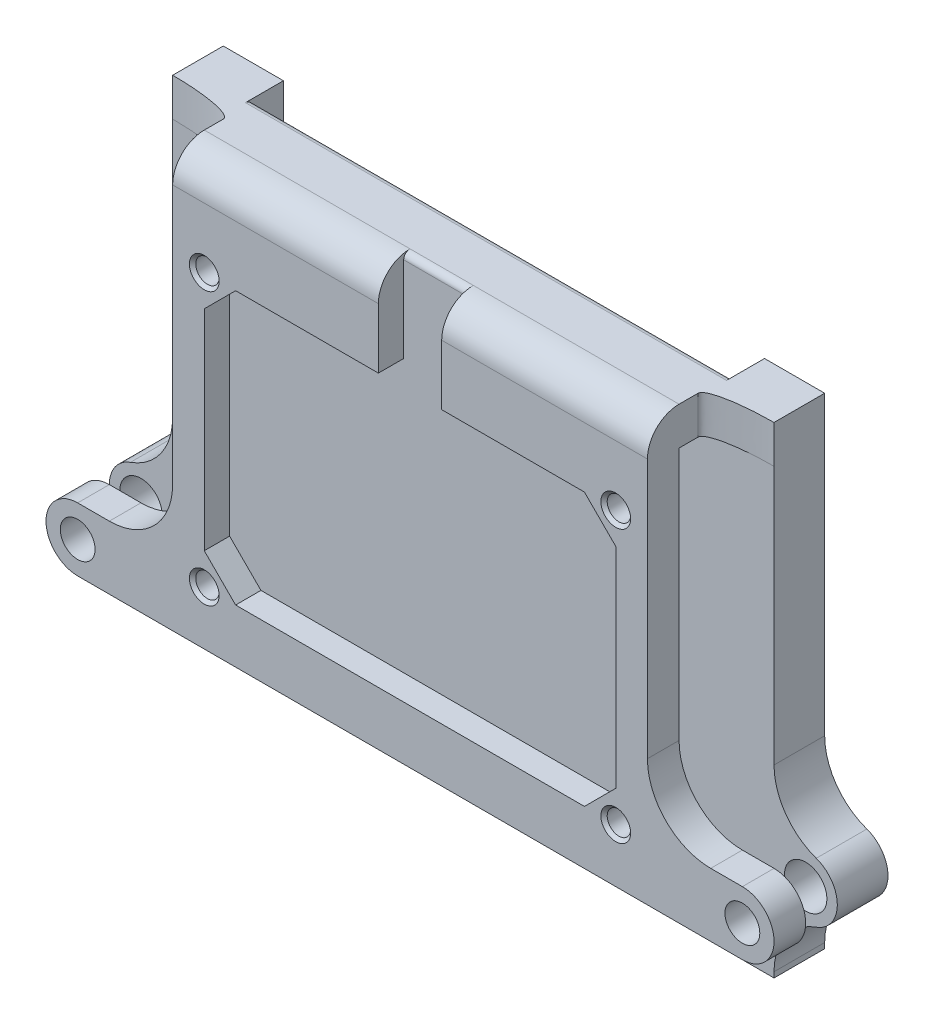
from build123d import *

# Parameters (mm, degrees)
SKETCH1_W           = 75
SKETCH1_H           = 6
SKETCH1_H_2         = 60
BOSS_EXTRUDE1_DEPTH = 5
SKETCH2_W           = 10
SKETCH2_H           = 14.5
CUT_EXTRUDE1_DEPTH  = 4
CUT_EXTRUDE2_DEPTH  = 4.5
SKETCH3_W           = 75
SKETCH3_H           = 6
BOSS_EXTRUDE2_DEPTH = 5
SKETCH4_W           = 95
SKETCH4_H           = 76
BOSS_EXTRUDE3_DEPTH = 8
SKETCH5_W           = 76
SKETCH5_H           = 76
CUT_EXTRUDE3_DEPTH  = 5
SKETCH5_3_R         = 1.85
CUT_EXTRUDE4_DEPTH  = 4.5
FILLET1_R           = 1
FILLET2_R           = 5
FILLET3_SIZE        = 10
FILLET3_SIZE_2      = 2
BOSS_EXTRUDE4_DEPTH = 5
BOSS_EXTRUDE5_START = -8
SKETCH8_R           = 5
SKETCH8_R_2         = 3.35
BOSS_EXTRUDE5_DEPTH = 8
FILLET4_R           = 10
CHAMFER1_SIZE       = 0.5


with BuildPart() as part:
    # Sketch1 → Boss-Extrude1 (new body)
    with BuildSketch(Plane.XY):
        with Locations((0, 83)):
            Rectangle(SKETCH1_W, SKETCH1_H)
        with Locations((0, 50)):
            Rectangle(SKETCH1_W, SKETCH1_H_2)
    extrude(amount=BOSS_EXTRUDE1_DEPTH)

    # Sketch2 → Cut-Extrude1 (cut)
    with BuildSketch(Plane.XY.offset(5)):
        Polygon((-27.550252532, 71.5), (-32.5, 66.550252532), (-32.5, 33.449747468), (-27.550252532, 28.5), (27.550252532, 28.5), (32.5, 33.449747468), (32.5, 66.550252532), (27.550252532, 71.5), (5, 71.5), (-5, 71.5), align=None)
        with Locations((0, 78.75)):
            Rectangle(SKETCH2_W, SKETCH2_H)
    extrude(amount=-CUT_EXTRUDE1_DEPTH, mode=Mode.SUBTRACT)

    # Sketch2<3> → Cut-Extrude2 (cut)
    with BuildSketch(Plane.XY.offset(5)):
        with BuildLine():
            ThreePointArc((-30.65, 71.5), (-33.808147545, 72.808147545), (-32.5, 69.65))
            Line((-32.5, 69.65), (-32.5, 71.5))
            Line((-32.5, 71.5), (-30.65, 71.5))
        make_face()
        with BuildLine():
            Line((-32.5, 71.5), (-32.5, 69.65))
            ThreePointArc((-32.5, 69.65), (-31.191852455, 70.191852455), (-30.65, 71.5))
            Line((-30.65, 71.5), (-32.5, 71.5))
        make_face()
        with BuildLine():
            ThreePointArc((34.35, 71.5), (32.5, 73.35), (30.65, 71.5))
            Line((30.65, 71.5), (32.5, 71.5))
            Line((32.5, 71.5), (32.5, 69.65))
            ThreePointArc((32.5, 69.65), (33.808147545, 70.191852455), (34.35, 71.5))
        make_face()
        with BuildLine():
            Line((32.5, 71.5), (30.65, 71.5))
            ThreePointArc((30.65, 71.5), (31.191852455, 70.191852455), (32.5, 69.65))
            Line((32.5, 69.65), (32.5, 71.5))
        make_face()
        with BuildLine():
            ThreePointArc((32.5, 30.35), (31.191852455, 29.808147545), (30.65, 28.5))
            Line((30.65, 28.5), (32.5, 28.5))
            Line((32.5, 28.5), (32.5, 30.35))
        make_face()
        with BuildLine():
            Line((32.5, 28.5), (30.65, 28.5))
            ThreePointArc((30.65, 28.5), (32.5, 26.65), (34.35, 28.5))
            ThreePointArc((34.35, 28.5), (33.808147545, 29.808147545), (32.5, 30.35))
            Line((32.5, 30.35), (32.5, 28.5))
        make_face()
        with BuildLine():
            ThreePointArc((-30.65, 28.5), (-31.191852455, 29.808147545), (-32.5, 30.35))
            Line((-32.5, 30.35), (-32.5, 28.5))
            Line((-32.5, 28.5), (-30.65, 28.5))
        make_face()
        with BuildLine():
            Line((-32.5, 28.5), (-32.5, 30.35))
            ThreePointArc((-32.5, 30.35), (-33.808147545, 27.191852455), (-30.65, 28.5))
            Line((-30.65, 28.5), (-32.5, 28.5))
        make_face()
    extrude(amount=-CUT_EXTRUDE2_DEPTH, mode=Mode.SUBTRACT)

    # Sketch3 → Boss-Extrude2 (add)
    with BuildSketch(Plane(origin=(0, 0, 0), x_dir=(-1, 0, 0), z_dir=(0, 0, -1))):
        with Locations((0, 83)):
            Rectangle(SKETCH3_W, SKETCH3_H)
    extrude(amount=BOSS_EXTRUDE2_DEPTH)

    # Sketch4 → Boss-Extrude3 (add)
    with BuildSketch(Plane(origin=(0, 0, -5), x_dir=(-1, 0, 0), z_dir=(0, 0, -1))):
        with Locations((0, 48)):
            Rectangle(SKETCH4_W, SKETCH4_H)
    extrude(amount=BOSS_EXTRUDE3_DEPTH)

    # Sketch5 → Cut-Extrude3 (cut)
    with BuildSketch(Plane(origin=(0, 0, -13), x_dir=(-1, 0, 0), z_dir=(0, 0, -1))):
        with Locations((0, 48)):
            Rectangle(SKETCH5_W, SKETCH5_H)
    extrude(amount=-CUT_EXTRUDE3_DEPTH, mode=Mode.SUBTRACT)

    # Sketch5<3> → Cut-Extrude4 (cut)
    with BuildSketch(Plane(origin=(0, 0, -13), x_dir=(-1, 0, 0), z_dir=(0, 0, -1))):
        with Locations((-41.5, 79)):
            Circle(SKETCH5_3_R)
        with Locations((-41.5, 21)):
            Circle(SKETCH5_3_R)
        with Locations((41.5, 21)):
            Circle(SKETCH5_3_R)
        with Locations((41.5, 79)):
            Circle(SKETCH5_3_R)
    extrude(amount=-CUT_EXTRUDE4_DEPTH, mode=Mode.SUBTRACT)

    # Fillet1
    fillet1_edges = [part.edges().sort_by_distance(p)[0] for p in [
        (0, 86, -8),
        (0, 86, 1),
    ]]
    fillet(fillet1_edges, radius=FILLET1_R)

    # Fillet2
    fillet2_edges = [part.edges().sort_by_distance(p)[0] for p in [
        (21.25, 86, 5),
        (-21.25, 86, 5),
    ]]
    fillet(fillet2_edges, radius=FILLET2_R)

    # Fillet3
    # an asymmetric fillet: 10, 2 mm, written as the material it adds along each edge
    with BuildSketch(Plane(origin=(37.5, 80, -5), x_dir=(1, 0, 0), z_dir=(0, 1, 0))) as fillet3_piece_1:
        with BuildLine():
            Bezier((FILLET3_SIZE, 0), (0, 0), (0, -FILLET3_SIZE_2), weights=[1, 0.707106781, 1])
            Line((0, -FILLET3_SIZE_2), (0, 0))
            Line((0, 0), (FILLET3_SIZE, 0))
        make_face()
    extrude(amount=6)
    with BuildSketch(Plane(origin=(-37.5, 86, -5), x_dir=(0, 0, 1), z_dir=(0, -1, 0))) as fillet3_piece_2:
        with BuildLine():
            Bezier((FILLET3_SIZE_2, 0), (0, 0), (0, FILLET3_SIZE), weights=[1, 0.707106781, 1])
            Line((0, FILLET3_SIZE), (0, 0))
            Line((0, 0), (FILLET3_SIZE_2, 0))
        make_face()
    extrude(amount=6)

    # Sketch7 → Boss-Extrude4 (add)
    with BuildSketch(Plane.XY.offset(5)):
        with BuildLine():
            Line((37.5, 30), (37.5, 20))
            Line((37.5, 20), (52.5, 20))
            ThreePointArc((52.5, 20), (47.5, 25), (52.5, 30))
            Line((52.5, 30), (37.5, 30))
        make_face()
        with BuildLine():
            ThreePointArc((52.5, 30), (47.5, 25), (52.5, 20))
            Line((52.5, 20), (52.5, 22.25))
            ThreePointArc((52.5, 22.25), (49.75, 25), (52.5, 27.75))
            Line((52.5, 27.75), (52.5, 30))
        make_face()
        with BuildLine():
            Line((52.5, 22.25), (52.5, 20))
            ThreePointArc((52.5, 20), (56.035533906, 21.464466094), (57.5, 25))
            ThreePointArc((57.5, 25), (56.035533906, 28.535533906), (52.5, 30))
            Line((52.5, 30), (52.5, 27.75))
            ThreePointArc((52.5, 27.75), (54.444543648, 26.944543648), (55.25, 25))
            ThreePointArc((55.25, 25), (54.444543648, 23.055456352), (52.5, 22.25))
        make_face()
        with BuildLine():
            Line((-37.5, 20), (-37.5, 30))
            Line((-37.5, 30), (-52.5, 30))
            ThreePointArc((-52.5, 30), (-48.964466094, 28.535533906), (-47.5, 25))
            ThreePointArc((-47.5, 25), (-48.964466094, 21.464466094), (-52.5, 20))
            Line((-52.5, 20), (-37.5, 20))
        make_face()
        with BuildLine():
            ThreePointArc((-47.5, 25), (-48.964466094, 28.535533906), (-52.5, 30))
            Line((-52.5, 30), (-52.5, 27.75))
            ThreePointArc((-52.5, 27.75), (-50.555456352, 26.944543648), (-49.75, 25))
            ThreePointArc((-49.75, 25), (-50.555456352, 23.055456352), (-52.5, 22.25))
            Line((-52.5, 22.25), (-52.5, 20))
            ThreePointArc((-52.5, 20), (-48.964466094, 21.464466094), (-47.5, 25))
        make_face()
        with BuildLine():
            Line((-52.5, 27.75), (-52.5, 30))
            ThreePointArc((-52.5, 30), (-57.5, 25), (-52.5, 20))
            Line((-52.5, 20), (-52.5, 22.25))
            ThreePointArc((-52.5, 22.25), (-55.25, 25), (-52.5, 27.75))
        make_face()
    extrude(amount=-BOSS_EXTRUDE4_DEPTH)

    # Sketch8 → Boss-Extrude5 (add)
    # profile 1 of 6: a face of its own
    with BuildSketch(Plane(origin=(0, 0, -13), x_dir=(-1, 0, 0), z_dir=(0, 0, -1)).offset(BOSS_EXTRUDE5_START)):
        with BuildLine():
            Line((-47.5, 20), (-47.5, 25))
            ThreePointArc((-47.5, 25), (-48.964466094, 21.464466094), (-52.5, 20))
            Line((-52.5, 20), (-47.5, 20))
        make_face()
    # profile 2 of 6: a face of its own
    with BuildSketch(Plane(origin=(0, 0, -13), x_dir=(-1, 0, 0), z_dir=(0, 0, -1)).offset(BOSS_EXTRUDE5_START)):
        with BuildLine():
            Line((-47.5, 30), (-52.5, 30))
            ThreePointArc((-52.5, 30), (-48.964466094, 28.535533906), (-47.5, 25))
            Line((-47.5, 25), (-47.5, 30))
        make_face()
    # profile 3 of 6: a face of its own
    with BuildSketch(Plane(origin=(0, 0, -13), x_dir=(-1, 0, 0), z_dir=(0, 0, -1)).offset(BOSS_EXTRUDE5_START)):
        with Locations((-52.5, 25)):
            Circle(SKETCH8_R)
        with Locations((-52.5, 25)):
            Circle(SKETCH8_R_2, mode=Mode.SUBTRACT)
    # profile 4 of 6: a face of its own
    with BuildSketch(Plane(origin=(0, 0, -13), x_dir=(-1, 0, 0), z_dir=(0, 0, -1)).offset(BOSS_EXTRUDE5_START)):
        with BuildLine():
            Line((47.5, 30), (47.5, 25))
            ThreePointArc((47.5, 25), (48.964466094, 28.535533906), (52.5, 30))
            Line((52.5, 30), (47.5, 30))
        make_face()
    # profile 5 of 6: a face of its own
    with BuildSketch(Plane(origin=(0, 0, -13), x_dir=(-1, 0, 0), z_dir=(0, 0, -1)).offset(BOSS_EXTRUDE5_START)):
        with BuildLine():
            Line((47.5, 25), (47.5, 20))
            Line((47.5, 20), (52.5, 20))
            ThreePointArc((52.5, 20), (48.964466094, 21.464466094), (47.5, 25))
        make_face()
    # profile 6 of 6: a face of its own
    with BuildSketch(Plane(origin=(0, 0, -13), x_dir=(-1, 0, 0), z_dir=(0, 0, -1)).offset(BOSS_EXTRUDE5_START)):
        with Locations((52.5, 25)):
            Circle(SKETCH8_R)
        with Locations((52.5, 25)):
            Circle(SKETCH8_R_2, mode=Mode.SUBTRACT)
    extrude(amount=BOSS_EXTRUDE5_DEPTH)

    # Fillet4
    # the kernel refuses this fillet: 10 mm, written as the material it adds along each edge
    with BuildSketch(Plane(origin=(37.5, 30, 5), x_dir=(0, 1, 0), z_dir=(0, 0, -1))) as fillet4_piece_1:
        with BuildLine():
            CenterArc((FILLET4_R, FILLET4_R), FILLET4_R, 180, 90)
            Line((0, FILLET4_R), (0, 0))
            Line((0, 0), (FILLET4_R, 0))
        make_face()
    extrude(amount=5)
    with BuildSketch(Plane(origin=(47.5, 20, -5), x_dir=(0, -1, 0), z_dir=(0, 0, -1)), Plane(origin=(-47.5, 30, -5), x_dir=(0, 1, 0), z_dir=(0, 0, -1))) as fillet4_piece_2:
        with BuildLine():
            CenterArc((9.142135624, -10), FILLET4_R, 90, 70.528779366)
            Line((-0.285954792, -6.666666667), (-1.228763834, -6.333333333))
            ThreePointArc((-1.228763834, -6.333333333), (-1, -5), (-1, 0))
            Line((-1, 0), (0, 1))
            Line((0, 1), (9.142135624, 1))
            Line((9.142135624, 1), (9.142135624, 0))
        make_face()
    extrude(amount=8)
    with BuildSketch(Plane(origin=(47.5, 30, -5), x_dir=(0, 1, 0), z_dir=(0, 0, -1)), Plane(origin=(-47.5, 20, -5), x_dir=(0, -1, 0), z_dir=(0, 0, -1))) as fillet4_piece_3:
        with BuildLine():
            CenterArc((9.142135624, 10), FILLET4_R, 199.471220634, 70.528779366)
            Line((-0.285954792, 6.666666667), (-1.228763834, 6.333333333))
            ThreePointArc((-1.228763834, 6.333333333), (-1, 5), (-1, 0))
            Line((-1, 0), (0, -1))
            Line((0, -1), (9.142135624, -1))
            Line((9.142135624, -1), (9.142135624, 0))
        make_face()
    extrude(amount=8)
    with BuildSketch(Plane(origin=(-37.5, 30, 5), x_dir=(0, 1, 0), z_dir=(0, 0, -1))) as fillet4_piece_4:
        with BuildLine():
            CenterArc((FILLET4_R, -FILLET4_R), FILLET4_R, 90, 90)
            Line((0, -FILLET4_R), (0, 0))
            Line((0, 0), (FILLET4_R, 0))
        make_face()
    extrude(amount=5)

    # Chamfer1
    chamfer1_edges = [part.edges().sort_by_distance(p)[0] for p in [
        (-39.65, 79, -13),
        (-39.65, 21, -13),
        (43.35, 21, -13),
        (43.35, 79, -13),
        (55.85, 25, -13),
        (-49.15, 25, -13),
        (-34.35, 28.5, 5),
        (30.65, 28.5, 5),
        (34.35, 71.5, 5),
        (-32.5, 73.35, 5),
    ]]
    chamfer(chamfer1_edges, length=CHAMFER1_SIZE)


solid = part.part
